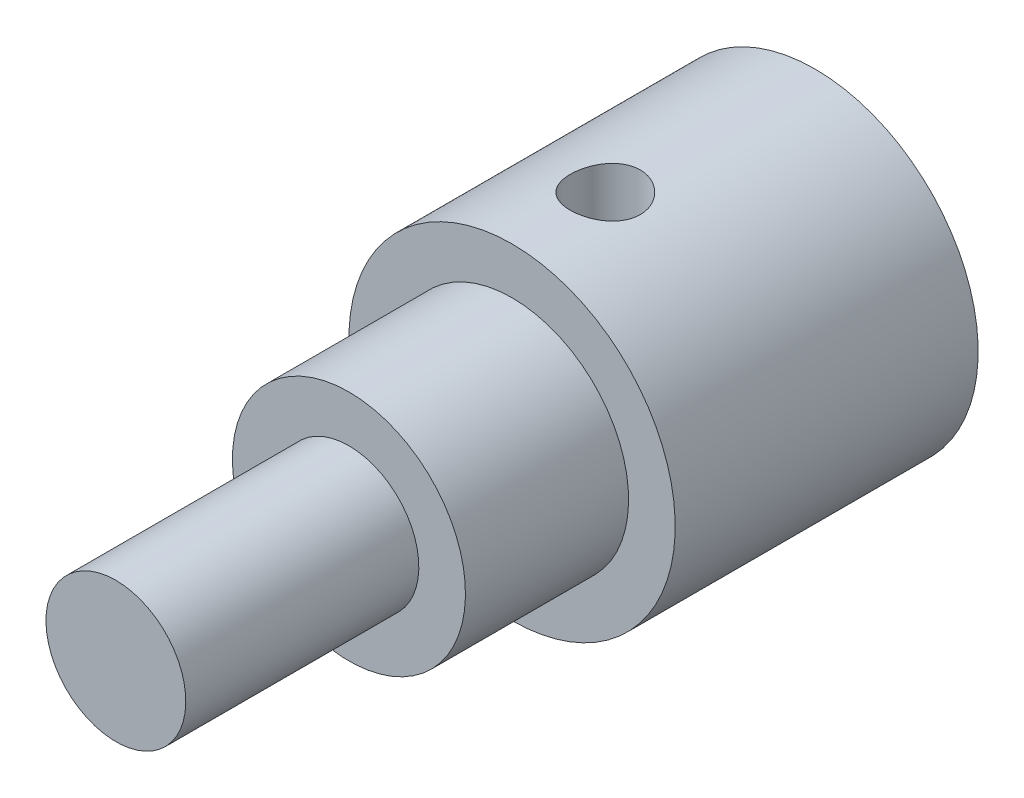
from build123d import *

# Parameters (mm, degrees)
CUT_EXTRUDE1_REACH             = 33.591
SKETCH2_R                      = 1.5
CUT_EXTRUDE1_DIRECTION_2_REACH = 33.591


with BuildPart() as part:
    # Sketch1 → Revolve1 (revolve)
    with BuildSketch(Plane(origin=(0, 0, 0), x_dir=(0, 0, -1), z_dir=(1, 0, 0))):
        Polygon((0, 0), (0, 3), (10, 3), (10, 5), (17, 5), (17, 7), (30, 7), (30, 3.2), (19.5, 3.2), (17.577246019, 0), align=None)
    revolve(axis=Axis((0, 0, -17.577246019), (0, 0, 1)))

    # Sketch2 → Cut-Extrude1 (cut, up to next)
    with BuildSketch(Plane(origin=(0, 0, 0), x_dir=(1, 0, 0), z_dir=(0, 1, 0)), mode=Mode.PRIVATE) as cut_extrude1_sk1:
        with Locations((0, 21)):
            Circle(SKETCH2_R)
    cut_extrude1_tool1 = extrude(cut_extrude1_sk1.sketch, amount=-CUT_EXTRUDE1_REACH, mode=Mode.PRIVATE) & part.part
    add(cut_extrude1_tool1.solids().sort_by_distance((0, 0, -21))[0], mode=Mode.SUBTRACT)

    # Sketch2 → Cut-Extrude1 direction 2 (cut, up to next)
    with BuildSketch(Plane(origin=(0, 0, 0), x_dir=(1, 0, 0), z_dir=(0, 1, 0)), mode=Mode.PRIVATE) as cut_extrude1_direction_2_sk1:
        with Locations((0, 21)):
            Circle(SKETCH2_R)
    cut_extrude1_direction_2_tool1 = extrude(cut_extrude1_direction_2_sk1.sketch, amount=CUT_EXTRUDE1_DIRECTION_2_REACH, mode=Mode.PRIVATE) & part.part
    add(cut_extrude1_direction_2_tool1.solids().sort_by_distance((0, 0, -21))[0], mode=Mode.SUBTRACT)


solid = part.part
